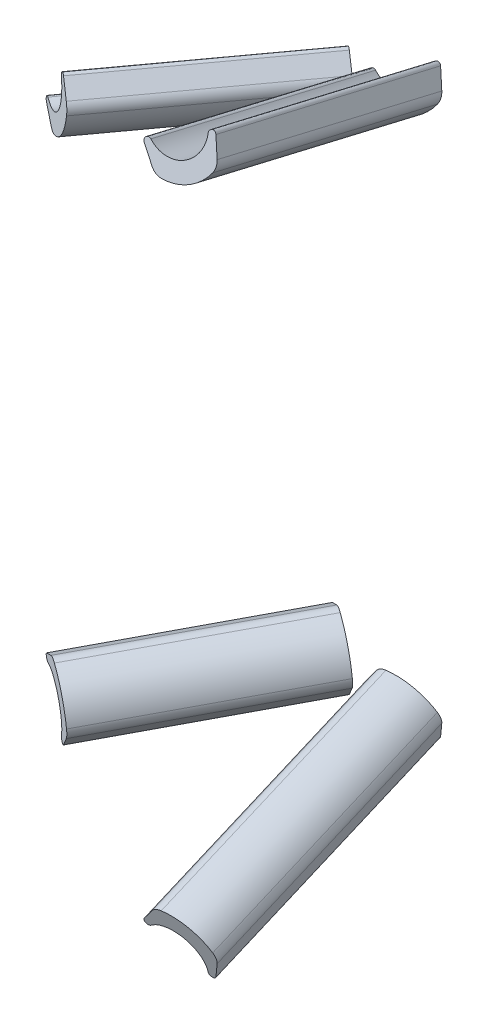
from build123d import *

# Parameters (mm, degrees)
STRUCTURAL_START           = 795.952077949
STRUCTURAL_MEMBER3_DEPTH   = 149.976135589
STRUCTURAL_START_2         = -697.998386167
STRUCTURAL_MEMBER3_2_DEPTH = 186.391537724


# Read off the part's stored shape, not the designer's step: Structural Member3
with BuildPart() as part:
    # Structural Member3 outline → Structural Member3 (new body)
    with BuildSketch(Plane(origin=(0, 0, 0), x_dir=(0.8483730398559017, 0.03220930397512309, 0.528418154479097), z_dir=(0.5293988904839683, -0.05161609821289462, -0.8468013894412433)).offset(STRUCTURAL_START)):
        with BuildLine():
            ThreePointArc((-9.987638451, -233.546710042), (-17.652980521, -217.494597975), (-32.481832864, -207.66948174))
            ThreePointArc((-32.481832864, -207.66948174), (-36.507474456, -207.261253054), (-40.339341683, -208.560958573))
            Line((-40.339341683, -208.560958573), (-51.595202921, -215.323981259))
            ThreePointArc((-51.595202921, -215.323981259), (-52.720721088, -216.992588021), (-52.165963282, -218.927344711))
            Line((-52.165963282, -218.927344711), (-51.993828977, -219.125367305))
            ThreePointArc((-51.993828977, -219.125367305), (-50.818836781, -219.861679152), (-49.432869841, -219.818581138))
            ThreePointArc((-49.432869841, -219.818581138), (-27.237890667, -225.826434358), (-24.377988855, -248.641612693))
            ThreePointArc((-24.377988855, -248.641612693), (-24.61358906, -250.008087845), (-24.048000184, -251.274133271))
            Line((-24.048000184, -251.274133271), (-23.875865879, -251.472155864))
            ThreePointArc((-23.875865879, -251.472155864), (-22.037164824, -252.290824358), (-20.228134118, -251.408527596))
            Line((-20.228134118, -251.408527596), (-11.96417436, -241.203633809))
            ThreePointArc((-11.96417436, -241.203633809), (-10.14373922, -237.589985129), (-9.987638451, -233.546710042))
        make_face()
    extrude(amount=STRUCTURAL_MEMBER3_DEPTH)


with BuildPart() as body_2:
    # Structural Member3 2 outline → Structural Member3 2 (new body)
    with BuildSketch(Plane(origin=(0, 0, 0), x_dir=(0.9965114665905763, -0.024141912103041747, -0.0798878278181833), z_dir=(0.08345595816656048, 0.2882681208702779, 0.9539059668208498)).offset(STRUCTURAL_START_2)):
        with BuildLine():
            ThreePointArc((568.128186494, 407.649541721), (585.464720991, 411.633552573), (598.284520868, 423.965644933))
            ThreePointArc((598.284520868, 423.965644933), (599.559991632, 427.805646914), (599.126338057, 431.828629074))
            Line((599.126338057, 431.828629074), (594.978034465, 444.287540157))
            ThreePointArc((594.978034465, 444.287540157), (593.594721137, 445.749553805), (591.585577038, 445.629638576))
            Line((591.585577038, 445.629638576), (591.354809064, 445.504781422))
            ThreePointArc((591.354809064, 445.504781422), (590.380194098, 444.518430843), (590.120302536, 443.156366905))
            ThreePointArc((590.120302536, 443.156366905), (579.421245957, 422.803441091), (556.531041464, 424.982876598))
            ThreePointArc((556.531041464, 424.982876598), (555.248719811, 425.51052513), (553.889864023, 425.234349926))
            Line((553.889864023, 425.234349926), (553.659096048, 425.109492772))
            ThreePointArc((553.659096048, 425.109492772), (552.459503511, 423.493319076), (552.92648117, 421.535521452))
            Line((552.92648117, 421.535521452), (561.085809999, 411.246778034))
            ThreePointArc((561.085809999, 411.246778034), (564.216044632, 408.682782709), (568.128186494, 407.649541721))
        make_face()
    extrude(amount=STRUCTURAL_MEMBER3_2_DEPTH)


with BuildPart() as body_3:
    # Mirror1: mirrored copy
    add(body_2.part.mirror(Plane.ZX))


with BuildPart() as body_4:
    # Mirror1 2: mirrored copy
    add(part.part.mirror(Plane.ZX))


solid = Compound([part.part, body_2.part, body_3.part, body_4.part])
